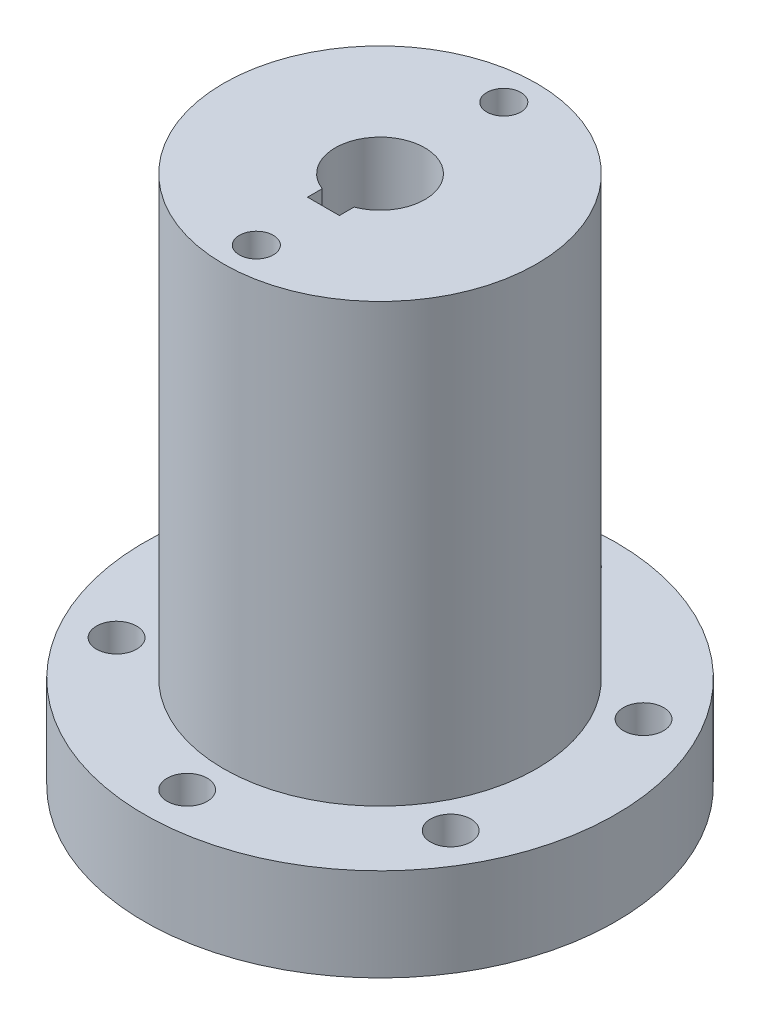
from build123d import *

# Parameters (mm, degrees)
SKETCH1_R           = 25.3
BOSS_EXTRUDE1_DEPTH = 8.5
SKETCH2_R           = 25.3
BOSS_EXTRUDE2_DEPTH = 57.15
SKETCH7_R           = 25.3
BOSS_EXTRUDE4_DEPTH = 15
CUT_EXTRUDE3_DEPTH  = 115
SKETCH6_R           = 38.1
BOSS_EXTRUDE3_DEPTH = 15
SKETCH9_R           = 3.25
CUT_EXTRUDE4_DEPTH  = 20
SKETCH10_R          = 2.75
CUT_EXTRUDE6_DEPTH  = 129
BOSS_EXTRUDE5_START = -93
BOSS_EXTRUDE5_DEPTH = 93
CUT_EXTRUDE7_DEPTH  = 40
CUT_EXTRUDE8_START  = -10
SKETCH12_R          = 25.3
CUT_EXTRUDE8_DEPTH  = 10


with BuildPart() as part:
    # Sketch1 → Boss-Extrude1 (new body)
    with BuildSketch(Plane(origin=(0, 0, 0), x_dir=(1, 0, 0), z_dir=(0, 1, 0))):
        Circle(SKETCH1_R)
    extrude(amount=BOSS_EXTRUDE1_DEPTH)

    # Sketch2 → Boss-Extrude2 (add)
    with BuildSketch(Plane(origin=(0, 8.5, 0), x_dir=(1, 0, 0), z_dir=(0, 1, 0))):
        Circle(SKETCH2_R)
    extrude(amount=BOSS_EXTRUDE2_DEPTH)

    # Sketch7 → Boss-Extrude4 (add)
    with BuildSketch(Plane(origin=(0, 65.65, 0), x_dir=(1, 0, 0), z_dir=(0, 1, 0))):
        Circle(SKETCH7_R)
    extrude(amount=BOSS_EXTRUDE4_DEPTH)

    # Sketch5 → Cut-Extrude3 (cut)
    with BuildSketch(Plane.XZ):
        with BuildLine():
            Line((2.575, 9.15), (-2.575, 9.15))
            Line((-2.575, 9.15), (-2.575, 6.777305881))
            ThreePointArc((-2.575, 6.777305881), (0, -7.25), (2.575, 6.777305881))
            Line((2.575, 6.777305881), (2.575, 9.15))
        make_face()
    extrude(amount=-CUT_EXTRUDE3_DEPTH, mode=Mode.SUBTRACT)

    # Sketch6 → Boss-Extrude3 (add)
    with BuildSketch(Plane.XZ):
        Circle(SKETCH6_R)
    extrude(amount=BOSS_EXTRUDE3_DEPTH)

    # Sketch9 → Cut-Extrude4 (cut)
    with BuildSketch(Plane(origin=(0, 0, 0), x_dir=(1, 0, 0), z_dir=(0, 1, 0))):
        with Locations((0, 31.176914536)):
            Circle(SKETCH9_R)
        with Locations((-27, 15.588457268)):
            Circle(SKETCH9_R)
        with Locations((27, 15.588457268)):
            Circle(SKETCH9_R)
        with Locations((-27, -15.588457268)):
            Circle(SKETCH9_R)
        with Locations((27, -15.588457268)):
            Circle(SKETCH9_R)
        with Locations((0, -31.176914536)):
            Circle(SKETCH9_R)
    extrude(amount=-CUT_EXTRUDE4_DEPTH, mode=Mode.SUBTRACT)

    # Sketch10 → Cut-Extrude6 (cut)
    with BuildSketch(Plane(origin=(0, 80.65, 0), x_dir=(1, 0, 0), z_dir=(0, 1, 0))):
        with Locations((0, 20)):
            Circle(SKETCH10_R)
        with Locations((0, -20)):
            Circle(SKETCH10_R)
    extrude(amount=-CUT_EXTRUDE6_DEPTH, mode=Mode.SUBTRACT)

    # Sketch11 → Boss-Extrude5 (add)
    with BuildSketch(Plane(origin=(0, 80.65, 0), x_dir=(1, 0, 0), z_dir=(0, 1, 0)).offset(BOSS_EXTRUDE5_START)):
        with BuildLine():
            Line((2.575, -9.15), (2.575, -6.777305881))
            ThreePointArc((2.575, -6.777305881), (0, 7.25), (-2.575, -6.777305881))
            Line((-2.575, -6.777305881), (-2.575, -9.15))
            Line((-2.575, -9.15), (2.575, -9.15))
        make_face()
    extrude(amount=BOSS_EXTRUDE5_DEPTH)

    # Sketch11<3> → Cut-Extrude7 (cut)
    with BuildSketch(Plane(origin=(0, 80.65, 0), x_dir=(1, 0, 0), z_dir=(0, 1, 0))):
        with BuildLine():
            Line((2.575, -9.15), (2.575, -6.777305881))
            ThreePointArc((2.575, -6.777305881), (0, 7.25), (-2.575, -6.777305881))
            Line((-2.575, -6.777305881), (-2.575, -9.15))
            Line((-2.575, -9.15), (2.575, -9.15))
        make_face()
    extrude(amount=-CUT_EXTRUDE7_DEPTH, mode=Mode.SUBTRACT)

    # Sketch12 → Cut-Extrude8 (cut)
    with BuildSketch(Plane(origin=(0, 80.65, 0), x_dir=(1, 0, 0), z_dir=(0, 1, 0)).offset(CUT_EXTRUDE8_START)):
        Circle(SKETCH12_R)
    extrude(amount=CUT_EXTRUDE8_DEPTH, mode=Mode.SUBTRACT)


solid = part.part
